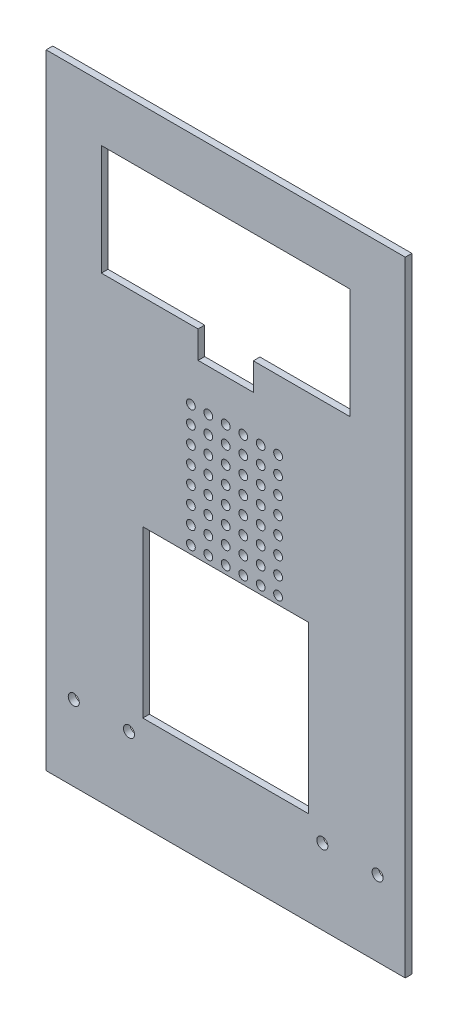
from build123d import *

# Parameters (mm, degrees)
SKETCH1_W           = 165.1
SKETCH1_H           = 292.1
BOSS_EXTRUDE1_DEPTH = 3.048
SKETCH2_W           = 76.2
SKETCH2_H           = 76.2
SKETCH2_R           = 2.0193
CUT_EXTRUDE1_DEPTH  = 168.792715289
CUT_EXTRUDE2_DEPTH  = 168.792715289
SKETCH5_R           = 2.54
CUT_EXTRUDE3_DEPTH  = 168.792715289
SKETCH6_W           = 165.1
SKETCH6_H           = 5.08
CUT_EXTRUDE4_DEPTH  = 168.792715289


with BuildPart() as part:
    # Sketch1 → Boss-Extrude1 (new body)
    with BuildSketch(Plane.XY):
        Rectangle(SKETCH1_W, SKETCH1_H)
    extrude(amount=BOSS_EXTRUDE1_DEPTH)

    # Sketch2 → Cut-Extrude1 (cut, through all)
    with BuildSketch(Plane.XY):
        with BuildLine():
            Line((8.086894284, 99.764589505), (8.086894284, 109.0549))
            Line((8.086894284, 109.0549), (-8.086894284, 109.0549))
            Line((-8.086894284, 109.0549), (-8.086894284, 99.764589505))
            ThreePointArc((-8.086894284, 99.764589505), (-10.7315, 92.71), (-8.086894284, 85.655410495))
            Line((-8.086894284, 85.655410495), (-8.086894284, 76.3651))
            Line((-8.086894284, 76.3651), (8.086894284, 76.3651))
            Line((8.086894284, 76.3651), (8.086894284, 85.655410495))
            ThreePointArc((8.086894284, 85.655410495), (10.7315, 92.71), (8.086894284, 99.764589505))
        make_face()
        with Locations((0, -59.69)):
            Rectangle(SKETCH2_W, SKETCH2_H)
        with Locations((0, 38.1)):
            Circle(SKETCH2_R)
        with Locations((0, 30.1)):
            Circle(SKETCH2_R)
        with Locations((0, 22.1)):
            Circle(SKETCH2_R)
        with Locations((0, 14.1)):
            Circle(SKETCH2_R)
        with Locations((0, 6.1)):
            Circle(SKETCH2_R)
        with Locations((0, -1.9)):
            Circle(SKETCH2_R)
        with Locations((0, -9.9)):
            Circle(SKETCH2_R)
        with Locations((0, -17.9)):
            Circle(SKETCH2_R)
        with Locations((-8, 38.1)):
            Circle(SKETCH2_R)
        with Locations((-16, 38.1)):
            Circle(SKETCH2_R)
        with Locations((-8, 30.1)):
            Circle(SKETCH2_R)
        with Locations((-16, 30.1)):
            Circle(SKETCH2_R)
        with Locations((-8, 22.1)):
            Circle(SKETCH2_R)
        with Locations((-16, 22.1)):
            Circle(SKETCH2_R)
        with Locations((-8, 14.1)):
            Circle(SKETCH2_R)
        with Locations((-16, 14.1)):
            Circle(SKETCH2_R)
        with Locations((-8, 6.1)):
            Circle(SKETCH2_R)
        with Locations((-16, 6.1)):
            Circle(SKETCH2_R)
        with Locations((-8, -1.9)):
            Circle(SKETCH2_R)
        with Locations((-16, -1.9)):
            Circle(SKETCH2_R)
        with Locations((-8, -9.9)):
            Circle(SKETCH2_R)
        with Locations((-16, -9.9)):
            Circle(SKETCH2_R)
        with Locations((-8, -17.9)):
            Circle(SKETCH2_R)
        with Locations((-16, -17.9)):
            Circle(SKETCH2_R)
        with Locations((24.086894284, 14.1)):
            Circle(SKETCH2_R)
        with Locations((8.086894284, 14.1)):
            Circle(SKETCH2_R)
        with Locations((8.086894284, -17.9)):
            Circle(SKETCH2_R)
        with Locations((24.086894284, 6.1)):
            Circle(SKETCH2_R)
        with Locations((16.086894284, 6.1)):
            Circle(SKETCH2_R)
        with Locations((8.086894284, -1.9)):
            Circle(SKETCH2_R)
        with Locations((8.086894284, 30.1)):
            Circle(SKETCH2_R)
        with Locations((24.086894284, 22.1)):
            Circle(SKETCH2_R)
        with Locations((24.086894284, -1.9)):
            Circle(SKETCH2_R)
        with Locations((24.086894284, -9.9)):
            Circle(SKETCH2_R)
        with Locations((8.086894284, 6.1)):
            Circle(SKETCH2_R)
        with Locations((16.086894284, 22.1)):
            Circle(SKETCH2_R)
        with Locations((8.086894284, 22.1)):
            Circle(SKETCH2_R)
        with Locations((8.086894284, -9.9)):
            Circle(SKETCH2_R)
        with Locations((24.086894284, -17.9)):
            Circle(SKETCH2_R)
        with Locations((16.086894284, 14.1)):
            Circle(SKETCH2_R)
        with Locations((16.086894284, -17.9)):
            Circle(SKETCH2_R)
        with Locations((16.086894284, 30.1)):
            Circle(SKETCH2_R)
        with Locations((24.086894284, 30.1)):
            Circle(SKETCH2_R)
        with Locations((16.086894284, -9.9)):
            Circle(SKETCH2_R)
        with Locations((16.086894284, -1.9)):
            Circle(SKETCH2_R)
        with Locations((16.086894284, 38.1)):
            Circle(SKETCH2_R)
        with Locations((8.086894284, 38.1)):
            Circle(SKETCH2_R)
        with Locations((24.086894284, 38.1)):
            Circle(SKETCH2_R)
    extrude(amount=CUT_EXTRUDE1_DEPTH, mode=Mode.SUBTRACT)

    # Sketch4 → Cut-Extrude2 (cut, through all)
    with BuildSketch(Plane.XY):
        Polygon((-12.7, 57.310847547), (-12.7, 69.85), (-57.15, 69.85), (-57.15, 120.65), (57.15, 120.65), (57.15, 69.85), (12.7, 69.85), (12.7, 57.310847547), align=None)
    extrude(amount=CUT_EXTRUDE2_DEPTH, mode=Mode.SUBTRACT)

    # Sketch5 → Cut-Extrude3 (cut, through all)
    with BuildSketch(Plane(origin=(0, 0, 0), x_dir=(-1, 0, 0), z_dir=(0, 0, -1))):
        with Locations((-44.45, -106.299)):
            Circle(SKETCH5_R)
        with Locations((-69.85, -106.299)):
            Circle(SKETCH5_R)
        with Locations((69.85, -106.299)):
            Circle(SKETCH5_R)
        with Locations((44.45, -106.299)):
            Circle(SKETCH5_R)
    extrude(amount=-CUT_EXTRUDE3_DEPTH, mode=Mode.SUBTRACT)

    # Sketch6 → Cut-Extrude4 (cut, through all)
    with BuildSketch(Plane(origin=(0, 0, 0), x_dir=(-1, 0, 0), z_dir=(0, 0, -1))):
        with Locations((0, -143.51)):
            Rectangle(SKETCH6_W, SKETCH6_H)
    extrude(amount=-CUT_EXTRUDE4_DEPTH, mode=Mode.SUBTRACT)


solid = part.part
